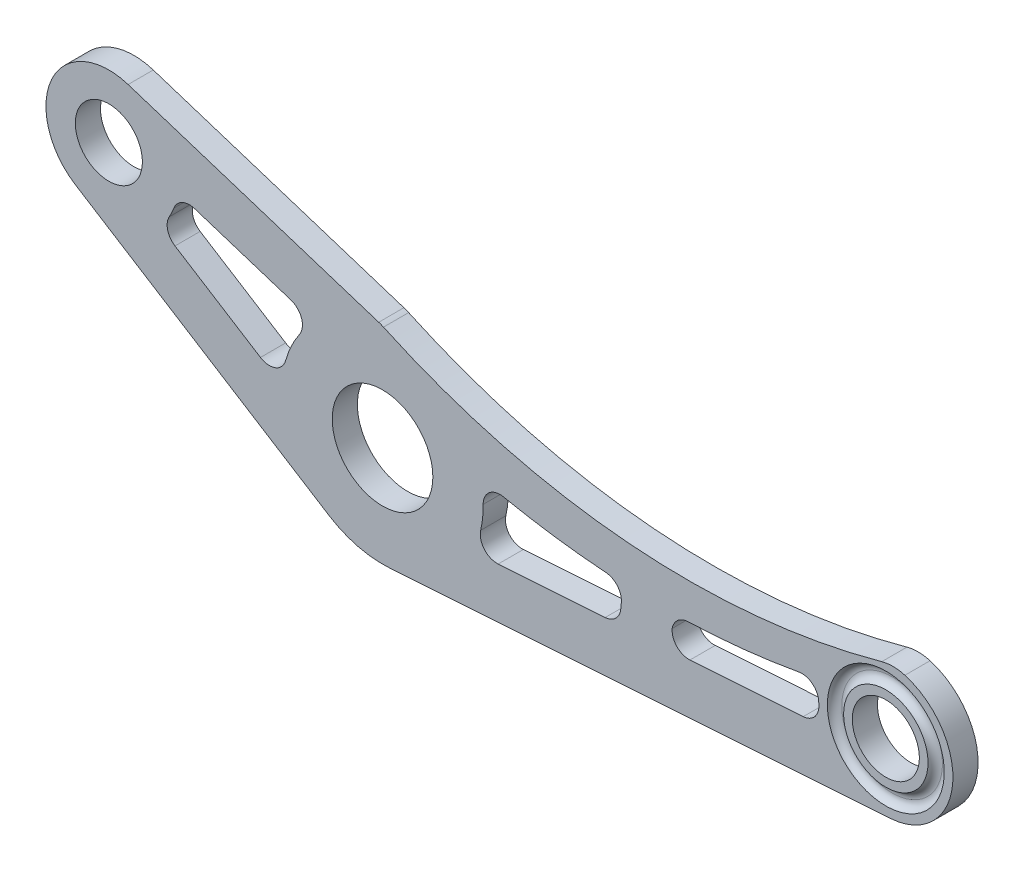
from build123d import *

# Parameters (mm, degrees)
EXTRUDE_1_DEPTH     = 3
SKETCH_2_R          = 4
SKETCH_2_R_2        = 6
CUT_EXTRUDE_1_DEPTH = 5
CUT_EXTRUDE_START   = -10
CUT_EXTRUDE_2_DEPTH = 10
FILLET_1_R          = 2
EXTRUDE_START       = -3
EXTRUDE_2_DEPTH     = 3
FILLET_3_R          = 2
EXTRUDE_START_2     = 0.25
SKETCH_6_R          = 8
EXTRUDE_3_DEPTH     = 0.25
SKETCH_7_R          = 7
SKETCH_7_R_2        = 5
CUT_EXTRUDE_4_DEPTH = 1
SKETCH_4_R          = 86.502313977
CUT_EXTRUDE_5_DEPTH = 11
FILLET_5_R          = 5
FILLET_6_R          = 1
SKETCH_8_R          = 14.07038583
CUT_EXTRUDE_6_DEPTH = 0.25


# Some blends are built 0.0001 mm under size
with BuildPart() as part:
    # 草图1 → 凸台-拉伸1 (new body)
    with BuildSketch(Plane.XY):
        with BuildLine():
            Line((60.533333333, -7.982202425), (0.8, -11.973303638))
            ThreePointArc((0.8, -11.973303638), (-2.939445104, -11.634417153), (-6.391104371, -10.156465178))
            Line((-6.391104371, -10.156465178), (-36.621520565, 8.866466686))
            ThreePointArc((-36.621520565, 8.866466686), (-39.424388736, 18.383894386), (-30.331967202, 22.3544574))
            Line((-30.331967202, 22.3544574), (-0.067539503, 12.626398572))
            ThreePointArc((-0.067539503, 12.626398572), (2.297970236, 12.022555106), (4.719428847, 11.711425782))
            Line((4.719428847, 11.711425782), (60.533333333, 7.982202425))
            ThreePointArc((60.533333333, 7.982202425), (68, 0), (60.533333333, -7.982202425))
        make_face()
    extrude(amount=EXTRUDE_1_DEPTH)

    # 草图2 → 切除-拉伸1 (cut)
    with BuildSketch(Plane.XY.offset(3)):
        with Locations((-32.627080333, 15.214257423)):
            Circle(SKETCH_2_R)
        with Locations((60, 0)):
            Circle(SKETCH_2_R)
        Circle(SKETCH_2_R_2)
    extrude(amount=-CUT_EXTRUDE_1_DEPTH, mode=Mode.SUBTRACT)

    # 草图3 → 切除-拉伸2 (cut)
    with BuildSketch(Plane.XY.offset(3).offset(CUT_EXTRUDE_START)):
        with BuildLine():
            Line((28.230392562, -4.127155499), (29.041000535, 4.072994476))
            Line((29.041000535, 4.072994476), (10.769185117, 5.293831496))
            ThreePointArc((10.769185117, 5.293831496), (11.688246691, 2.71751528), (12, 0))
            ThreePointArc((12, 0), (11.688246691, -2.71751528), (10.769185117, -5.293831496))
            Line((10.769185117, -5.293831496), (28.230392562, -4.127155499))
        make_face()
        with BuildLine():
            ThreePointArc((-11.991309043, 0.456626154), (-10.875693444, 5.071419141), (-8.057660805, 8.892362024))
            Line((-8.057660805, 8.892362024), (-24.425138032, 14.153448832))
            ThreePointArc((-24.425138032, 14.153448832), (-25.131680833, 11.719095235), (-26.54234692, 9.613079718))
            Line((-26.54234692, 9.613079718), (-11.991309043, 0.456626154))
        make_face()
        with BuildLine():
            Line((52.404599069, 2.511948386), (35.030683756, 3.672791932))
            Line((35.030683756, 3.672791932), (34.299724154, -3.721631224))
            Line((34.299724154, -3.721631224), (52.404599069, -2.511948386))
            ThreePointArc((52.404599069, -2.511948386), (52, 0), (52.404599069, 2.511948386))
        make_face()
    extrude(amount=CUT_EXTRUDE_2_DEPTH, mode=Mode.SUBTRACT)

    # 圆角1
    fillet_1_edges = [part.edges().sort_by_distance(p)[0] for p in [
        (52.404599069, 2.511948386, 1.5),
        (52.404599069, -2.511948386, 1.5),
        (34.299724154, -3.721631224, 1.5),
        (35.030683756, 3.672791932, 1.5),
        (-26.54234692, 9.613079718, 1.5),
        (-24.425138032, 14.153448832, 1.5),
        (-8.057660805, 8.892362024, 1.5),
        (-11.991309043, 0.456626154, 1.5),
        (10.769185117, -5.293831496, 1.5),
        (10.769185117, 5.293831496, 1.5),
        (29.041000535, 4.072994476, 1.5),
        (28.230392562, -4.127155499, 1.5),
    ]]
    fillet(fillet_1_edges, radius=FILLET_1_R)

    # 草图5 → 凸台-拉伸2 (add)
    with BuildSketch(Plane.XY.offset(3).offset(EXTRUDE_START)):
        with BuildLine():
            Line((-24.540394024, 20.492840682), (-0.067539503, 12.626398572))
            ThreePointArc((-0.067539503, 12.626398572), (29.515306686, 4.823317954), (59.944614351, 7.999808275))
            ThreePointArc((59.944614351, 7.999808275), (62.829825639, 7.482786036), (65.335143615, 5.96122828))
            ThreePointArc((65.335143615, 5.96122828), (18.485789408, 1.404205763), (-24.540394024, 20.492840682))
        make_face()
    extrude(amount=EXTRUDE_2_DEPTH)

    # 圆角3
    # the kernel refuses this fillet: 2 mm, written as the material it adds along each edge
    with BuildSketch(Plane(origin=(51.482720464, 2.033055033, 0), x_dir=(-0.982319810641478, -0.18721054890494518, 0), z_dir=(0, 0, 1))) as fillet_3_piece_1:
        with BuildLine():
            CenterArc((1.886422925, 1.999898233), FILLET_3_R, 170.841064361, 98.580936146)
            Line((-0.088078274, 2.318245549), (-0.285528394, 2.350080281))
            ThreePointArc((-0.285528394, 2.350080281), (-0.438383872, 1.623834826), (-0.169045436, -0.106881432))
            Line((-0.169045436, -0.106881432), (0.002017565, -0.199989823))
            ThreePointArc((0.002017565, -0.199989823), (0.933123639, -0.195293287), (1.864229714, -0.199989823))
            Line((1.864229714, -0.199989823), (1.866247279, 0))
        make_face()
    extrude(amount=3)
    with BuildSketch(Plane(origin=(34.690308342, 0.229537561, 3), x_dir=(-0.09837334507512366, -0.995149579198389, 0), z_dir=(0, 0, -1))) as fillet_3_piece_2:
        with BuildLine():
            CenterArc((1.767742063, -1.99371148), FILLET_3_R, 94.544757631, 77.838582335)
            Line((-0.214612021, -1.728622274), (-0.254259103, -1.72332049))
            ThreePointArc((-0.254259103, -1.72332049), (-0.142932142, -0.859888079), (-0.039739887, 0.004554272))
            Line((-0.039739887, 0.004554272), (0, 0.04))
            ThreePointArc((0, 0.04), (0.8046332, 0.04), (1.606096886, 0.03987423))
            Line((1.606096886, 0.03987423), (1.6092664, 0))
        make_face()
    extrude(amount=3)
    with BuildSketch(Plane(origin=(28.671165111, 0.331721205, 3), x_dir=(-0.9981625762582289, 0.060592667522857975, 0), z_dir=(0, 0, -1))) as fillet_3_piece_3:
        with BuildLine():
            CenterArc((2.077274931, -1.999876599), FILLET_3_R, 90.636478793, 91.535197335)
            Line((0.078711388, -2.075664247), (0.038740118, -2.07718))
            Line((0.038740118, -2.07718), (-0.039971271, -0.001515753))
            Line((-0.039971271, -0.001515753), (0.000444337, 0.039997532))
            ThreePointArc((0.000444337, 0.039997532), (1.027529043, 0.034292711), (2.05461375, 0.039997532))
            Line((2.05461375, 0.039997532), (2.055058086, 0))
        make_face()
    extrude(amount=3)
    with BuildSketch(Plane(origin=(11.680363127, 2.768333075, 0), x_dir=(0.12170231269855974, -0.9925666461673099, 0), z_dir=(0, 0, 1))) as fillet_3_piece_4:
        with BuildLine():
            CenterArc((2.831331682, 1.988408565), FILLET_3_R, 161.255131194, 102.573219996)
            Line((0.937413857, 2.631117886), (0.748022074, 2.695388818))
            ThreePointArc((0.748022074, 2.695388818), (0.290238781, 1.379143519), (-0.187364942, 0.069959836))
            Line((-0.187364942, 0.069959836), (0.008579816, -0.199815882))
            ThreePointArc((0.008579816, -0.199815882), (0.136091641, -0.190622784), (2.594815369, -0.198840857))
            Line((2.594815369, -0.198840857), (2.616316852, 0))
        make_face()
    extrude(amount=3)

    # 草图6 → 凸台-拉伸3 (add)
    with BuildSketch(Plane(origin=(0, 0, 0), x_dir=(-1, 0, 0), z_dir=(0, 0, -1)).offset(EXTRUDE_START_2)):
        with Locations((-60, 0)):
            Circle(SKETCH_6_R)
    extrude(amount=-EXTRUDE_3_DEPTH)

    # 草图7 → 切除-拉伸4 (cut)
    with BuildSketch(Plane(origin=(0, 0, -0.25), x_dir=(-1, 0, 0), z_dir=(0, 0, -1))):
        with Locations((-60, 0)):
            Circle(SKETCH_7_R)
        with Locations((-60, 0)):
            Circle(SKETCH_7_R_2, mode=Mode.SUBTRACT)
    extrude(amount=-CUT_EXTRUDE_4_DEPTH, mode=Mode.SUBTRACT)

    # 草图4 → 切除-拉伸5 (cut)
    with BuildSketch(Plane.XY.offset(3)):
        with Locations((36.403919295, 91.050979361)):
            Circle(SKETCH_4_R)
    extrude(amount=-CUT_EXTRUDE_5_DEPTH, mode=Mode.SUBTRACT)

    # 圆角5
    fillet_5_edges = [part.edges().sort_by_distance(p)[0] for p in [
        (60.533333333, 7.982202425, 1.375),
        (-0.158941589, 12.65577844, 1.5),
    ]]
    fillet(fillet_5_edges, radius=FILLET_5_R)

    # 圆角6
    fillet_6_edges = [part.edges().sort_by_distance(p)[0] for p in [
        (67, 0, 0.75),
        (65, 0, 0.75),
    ]]
    fillet(fillet_6_edges, radius=FILLET_6_R - 0.0001)  # a hair under: the kernel refuses the full size

    # 草图8 → 切除-拉伸6 (cut)
    with BuildSketch(Plane(origin=(0, 0, -0.25), x_dir=(-1, 0, 0), z_dir=(0, 0, -1))):
        with Locations((-60, 0)):
            Circle(SKETCH_8_R)
    extrude(amount=-CUT_EXTRUDE_6_DEPTH, mode=Mode.SUBTRACT)


with BuildPart() as body_2:
    # 镜向1: mirrored copy
    add(part.part.mirror(Plane.XY))


solid = body_2.part
